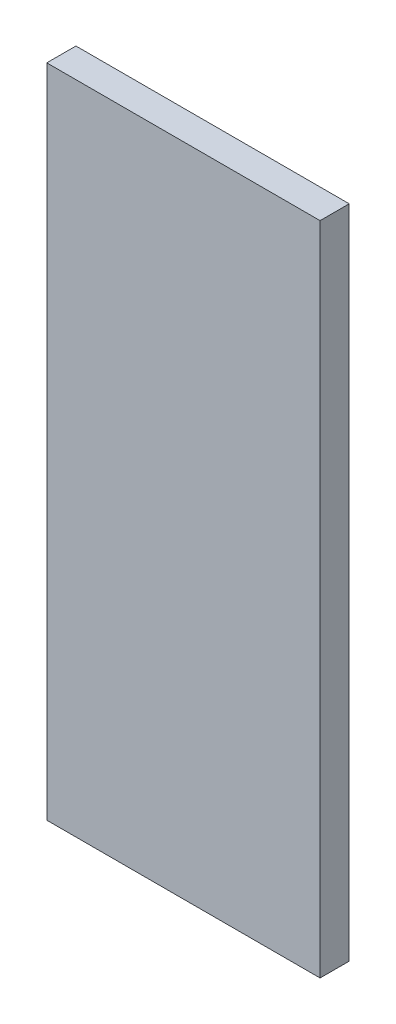
from build123d import *

# Parameters (mm, degrees)
SKETCH_1_W             = 75
SKETCH_1_H             = 180
SM_BASE_FLANGE_1_DEPTH = 8


# Sheet-metal steps are written as plain solids
with BuildPart() as part:
    # Sketch 1 → Базовая кромка1 (new body)
    with BuildSketch(Plane.XY):
        with Locations((37.5, -90)):
            Rectangle(SKETCH_1_W, SKETCH_1_H)
    extrude(amount=-SM_BASE_FLANGE_1_DEPTH)


solid = part.part
